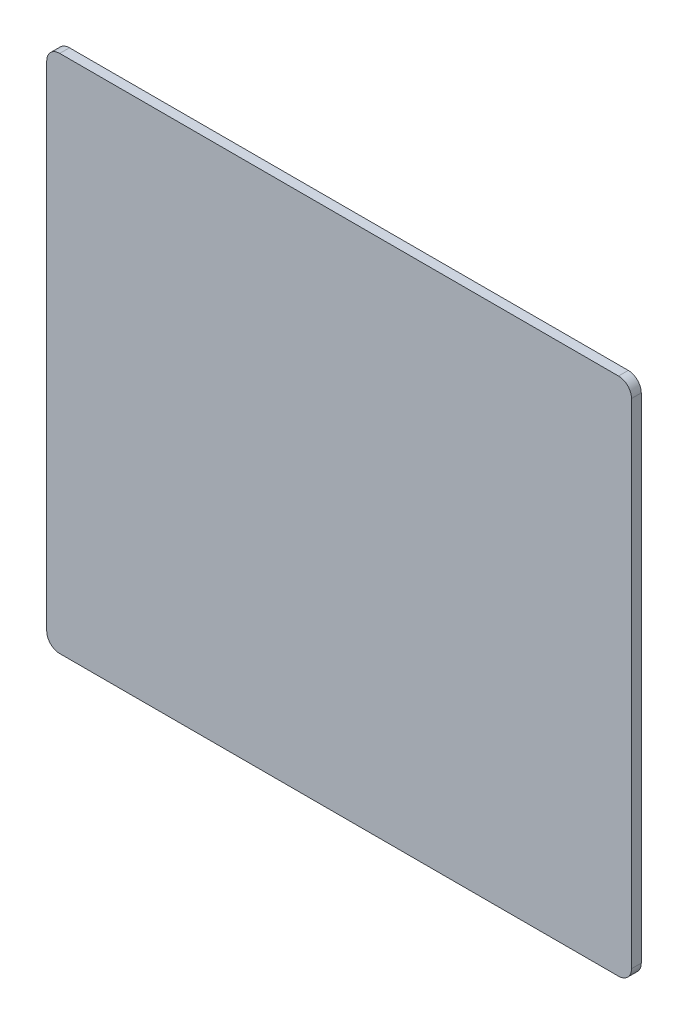
from build123d import *

# Parameters (mm, degrees)
SM_BASE_FLANGE_1_DEPTH = 1.5


# Sheet-metal steps are written as plain solids
with BuildPart() as part:
    # Sketch 1 → Базовая кромка1 (new body)
    with BuildSketch(Plane.XY):
        with BuildLine():
            Line((51.5, 19.107274431), (-34.5, 19.107274431))
            ThreePointArc((-34.5, 19.107274431), (-35.914213562, 18.521487993), (-36.5, 17.107274431))
            Line((-36.5, 17.107274431), (-36.5, -58.892725569))
            ThreePointArc((-36.5, -58.892725569), (-35.914213562, -60.306939132), (-34.5, -60.892725569))
            Line((-34.5, -60.892725569), (51.5, -60.892725569))
            ThreePointArc((51.5, -60.892725569), (52.914213562, -60.306939132), (53.5, -58.892725569))
            Line((53.5, -58.892725569), (53.5, 17.107274431))
            ThreePointArc((53.5, 17.107274431), (52.914213562, 18.521487993), (51.5, 19.107274431))
        make_face()
    extrude(amount=-SM_BASE_FLANGE_1_DEPTH)


solid = part.part
